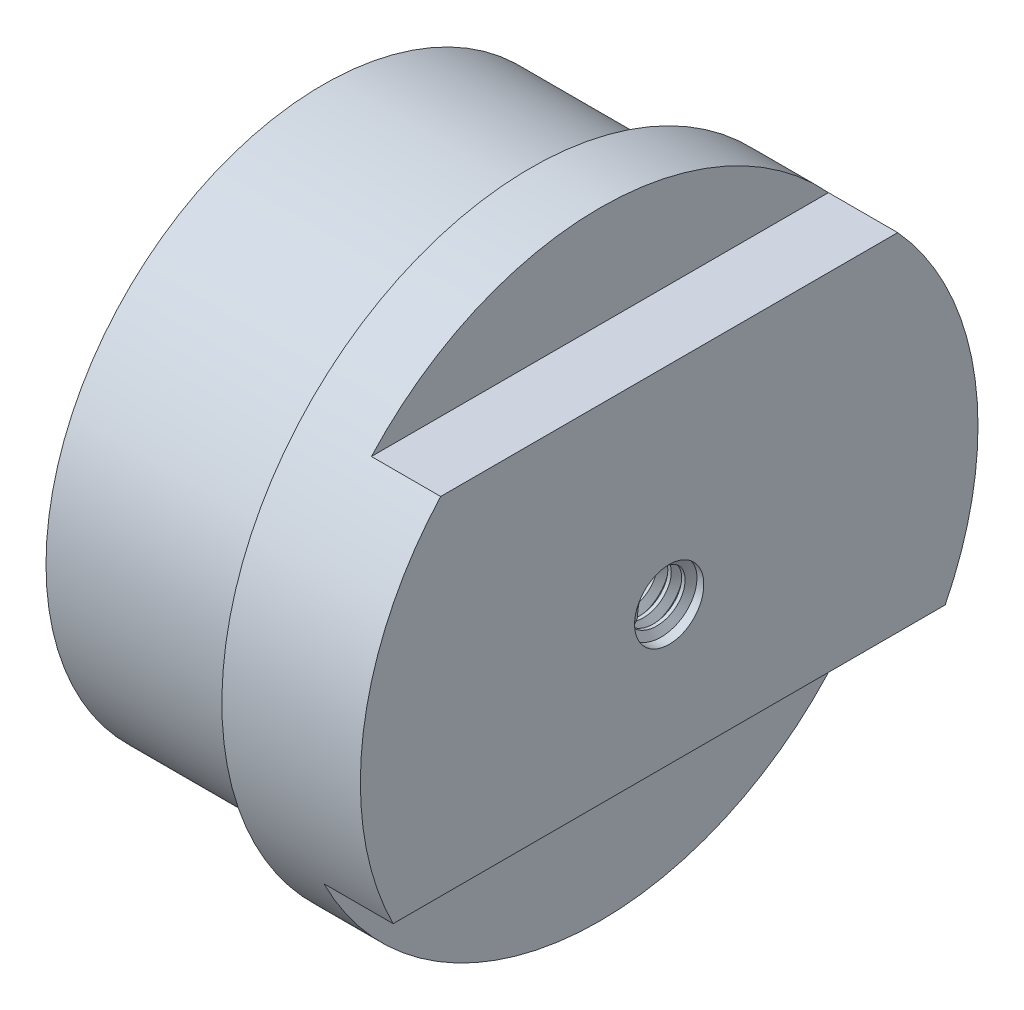
from build123d import *

# Parameters (mm, degrees)
SKETCH1_R                   = 25.4
BOSS_EXTRUDE1_DEPTH         = 19.05
SKETCH2_R                   = 28.321
BOSS_EXTRUDE2_DEPTH         = 6.35
BOSS_EXTRUDE3_DEPTH         = 6.35
F_1_4_0_25_DIAMETER_HOLE1_D = 6.35
THREAD1_PITCH               = 1.27


with BuildPart() as part:
    # Sketch1 → Boss-Extrude1 (new body)
    with BuildSketch(Plane(origin=(0, 0, 0), x_dir=(0, 0, -1), z_dir=(1, 0, 0))):
        with Locations(Location((0, 0, 0), (0, 0, 180))):
            Circle(SKETCH1_R)
    extrude(amount=BOSS_EXTRUDE1_DEPTH)

    # Sketch2 → Boss-Extrude2 (add)
    with BuildSketch(Plane(origin=(19.05, 0, 0), x_dir=(0, 0, -1), z_dir=(1, 0, 0))):
        Circle(SKETCH2_R)
    extrude(amount=BOSS_EXTRUDE2_DEPTH)

    # Sketch3 → Boss-Extrude3 (add)
    with BuildSketch(Plane(origin=(25.4, 0, 0), x_dir=(0, 0, -1), z_dir=(1, 0, 0))):
        with BuildLine():
            Line((-25.31381127, -12.7), (25.31381127, -12.7))
            ThreePointArc((25.31381127, -12.7), (28.058010645, 3.850594717), (20.956539337, 19.05))
            Line((20.956539337, 19.05), (-20.956539337, 19.05))
            ThreePointArc((-20.956539337, 19.05), (-28.058010645, 3.850594717), (-25.31381127, -12.7))
        make_face()
    extrude(amount=BOSS_EXTRUDE3_DEPTH)

    # 1/4 (0.25) Diameter Hole1 (through all)
    with Locations(Plane(origin=(31.75, 0, 0), x_dir=(0, 0, -1), z_dir=(1, 0, 0))):
        with Locations((0, 0)):
            Hole(F_1_4_0_25_DIAMETER_HOLE1_D / 2)

    # Thread1: the profile of Thread Profile1 profile screwed along a right-hand helix of 25 turns, 8 arcs to a turn; built about Z, then put on its axis
    thread1_z = Axis((0, 0, 0), (0, 0, 1))
    thread1_corners = [(3.1753, 0, -0.000173205), (3.1753, 0, 1.111423202), (2.487592339, 0, 0.714374998), (2.487592339, 0, 0.396874998)]
    with BuildLine(mode=Mode.PRIVATE) as thread1_profile:
        Line(thread1_corners[0], thread1_corners[1])
        Line(thread1_corners[1], thread1_corners[2])
        Line(thread1_corners[2], thread1_corners[3])
        Line(thread1_corners[3], thread1_corners[0])
    thread1_cap = Face(thread1_profile.wire())
    thread1_turn_angles = [0, 22.5, 45, 67.5, 90, 112.5, 135, 157.5, 180, 202.5, 225, 247.5, 270, 292.5, 315, 337.5, 360]
    thread1_turn_weights = [1, 0.9238795325112867, 1, 0.9238795325112867, 1, 0.9238795325112867, 1, 0.9238795325112867, 1, 0.9238795325112867, 1, 0.9238795325112867, 1, 0.9238795325112867, 1, 0.9238795325112867, 1]
    thread1_turn_rails = [Edge.make_bspline([Vector(p[0], p[1], 0).rotate(thread1_z, thread1_turn_angles[k]) / thread1_turn_weights[k] + Vector(0, 0, p[2] + THREAD1_PITCH * thread1_turn_angles[k] / 360) for k in range(17)], [0, 0, 0, 1, 1, 2, 2, 3, 3, 4, 4, 5, 5, 6, 6, 7, 7, 8, 8, 8], 2, thread1_turn_weights) for p in thread1_corners]
    thread1_turn_sides = [Face.make_surface_from_curves(thread1_turn_rails[p[0]], thread1_turn_rails[p[1]]) for p in [(0, 1), (1, 2), (2, 3), (3, 0)]]
    thread1 = Plane(origin=(31.75, 0, 0), x_dir=(0, 0, 1), z_dir=(-1, 0, 0)) * Solid(Shell([*[p.moved(Location((0, 0, THREAD1_PITCH * i))) for i in range(25) for p in thread1_turn_sides], thread1_cap, thread1_cap.rotate(thread1_z, 9000).moved(Location((0, 0, THREAD1_PITCH * 9000 / 360)))]))
    add(thread1)


solid = part.part
